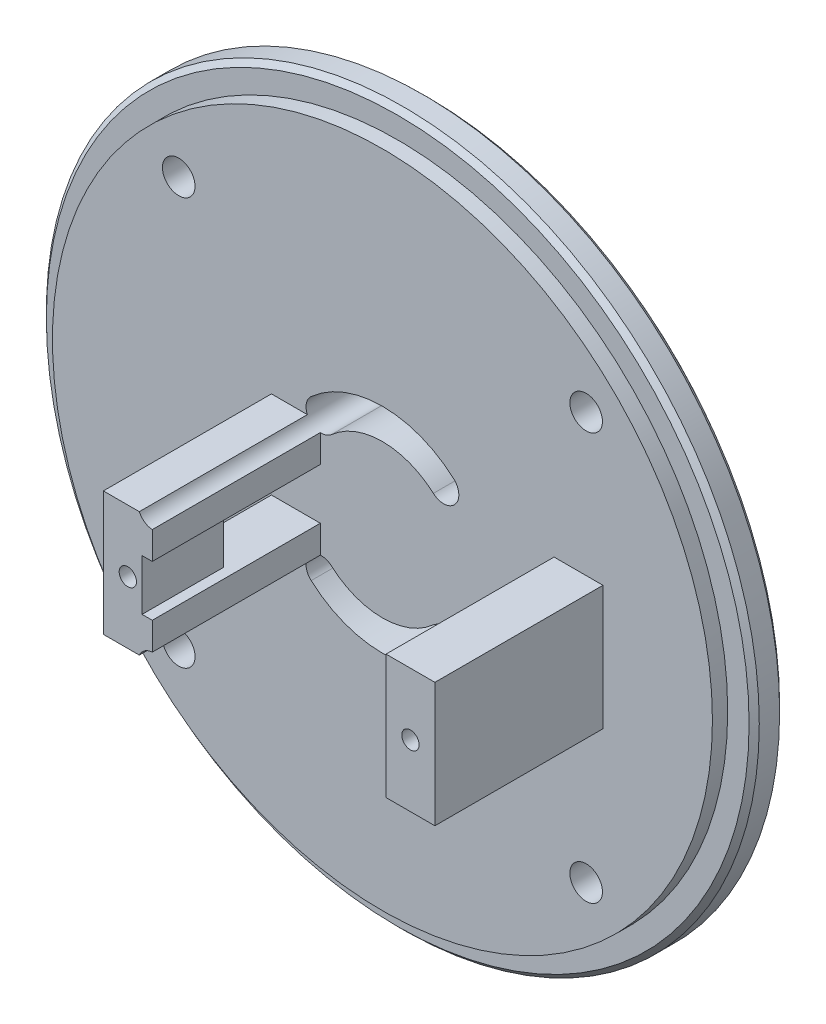
from build123d import *

# Parameters (mm, degrees)
SKIZZE1_R                       = 32.4
SKIZZE1_R_2                     = 1.8
AUFSATZ_LINEAR_AUSTRAGEN1_DEPTH = 3
SCHNITT_LINEAR_AUSTRAGEN1_DEPTH = 46.918623673
AUFSATZ_LINEAR_START            = 18
SKIZZE4_R                       = 0.85
SKIZZE4_W                       = 4.8
SKIZZE4_H                       = 12.19937625
AUFSATZ_LINEAR_AUSTRAGEN2_DEPTH = 18
SKIZZE5_W                       = 2
SKIZZE5_H                       = 5
SCHNITT_LINEAR_AUSTRAGEN2_DEPTH = 18
SKIZZE6_W                       = 10
SKIZZE6_H                       = 5
SCHNITT_LINEAR_AUSTRAGEN3_DEPTH = 18
FL_CHE_VERSCHIEBEN1_BY          = 1.5
SKIZZE8_R                       = 35
SKIZZE8_R_2                     = 32.4
AUFSATZ_LINEAR_AUSTRAGEN3_DEPTH = 3
SKIZZE9_R                       = 1.8
SKIZZE9_R_2                     = 1.6
AUFSATZ_LINEAR_AUSTRAGEN4_DEPTH = 4.5
FL_CHE_VERSCHIEBEN2_OUTLINE_R   = 35
FL_CHE_VERSCHIEBEN2_OUTLINE_R_2 = 1.6
FL_CHE_VERSCHIEBEN2_OUTLINE_W   = 4.8
FL_CHE_VERSCHIEBEN2_OUTLINE_H   = 12.19937625
FL_CHE_VERSCHIEBEN2_DEPTH       = 1.5
SKIZZE10_R                      = 36.675991258
SKIZZE10_R_2                    = 32.4
SCHNITT_LINEAR_AUSTRAGEN4_DEPTH = 1.5
FASE1_SIZE                      = 0.5


# Read off the part's stored shape, not the designer's step: Fläche verschieben2
with BuildPart() as part:
    # Skizze1 → Aufsatz-Linear austragen1 (new body)
    with BuildSketch(Plane.XY):
        Circle(SKIZZE1_R)
        with Locations((-20, -20)):
            Circle(SKIZZE1_R_2, mode=Mode.SUBTRACT)
        with Locations((20, -20)):
            Circle(SKIZZE1_R_2, mode=Mode.SUBTRACT)
        with Locations((20, 20)):
            Circle(SKIZZE1_R_2, mode=Mode.SUBTRACT)
        with Locations((-20, 20)):
            Circle(SKIZZE1_R_2, mode=Mode.SUBTRACT)
    extrude(amount=-AUFSATZ_LINEAR_AUSTRAGEN1_DEPTH)

    # Skizze2 → Schnitt-Linear austragen1 (cut, through all)
    with BuildSketch(Plane.XY):
        with BuildLine():
            ThreePointArc((5, 5.590169944), (0, 7.5), (-5, 5.590169944))
            ThreePointArc((-5, 5.590169944), (-5.511799249, 5.289873919), (-6.1, 5.211540978))
            ThreePointArc((-6.1, 5.211540978), (-6.859313681, 5.478740636), (-7.371163001, 6.1))
            ThreePointArc((-7.371163001, 6.1), (-7.466484857, 7.023516737), (-7, 7.826237921))
            ThreePointArc((-7, 7.826237921), (0, 10.5), (7, 7.826237921))
            ThreePointArc((7, 7.826237921), (7.118033989, 5.708203932), (5, 5.590169944))
        make_face()
        with BuildLine():
            ThreePointArc((-7, -7.826237921), (0, -10.5), (7, -7.826237921))
            ThreePointArc((7, -7.826237921), (7.118033989, -5.708203932), (5, -5.590169944))
            ThreePointArc((5, -5.590169944), (0, -7.5), (-5, -5.590169944))
            ThreePointArc((-5, -5.590169944), (-5.511799249, -5.289873919), (-6.1, -5.211540978))
            ThreePointArc((-6.1, -5.211540978), (-6.859313681, -5.478740636), (-7.371163001, -6.1))
            ThreePointArc((-7.371163001, -6.1), (-7.466484857, -7.023516737), (-7, -7.826237921))
        make_face()
    extrude(amount=-SCHNITT_LINEAR_AUSTRAGEN1_DEPTH, mode=Mode.SUBTRACT)

    # Skizze4 → Aufsatz-Linear austragen2 (add)
    # profile 1 of 2: a face of its own
    with BuildSketch(Plane.XY.offset(AUFSATZ_LINEAR_START)):
        with BuildLine():
            Line((-10.9, 6.1), (-10.9, -6.1))
            Line((-10.9, -6.1), (-7.371163001, -6.1))
            ThreePointArc((-7.371163001, -6.1), (-6.859313681, -5.478740636), (-6.1, -5.211540978))
            Line((-6.1, -5.211540978), (-6.1, 0.782623792))
            Line((-6.1, 0.782623792), (-6.1, 5.211540978))
            ThreePointArc((-6.1, 5.211540978), (-6.859313681, 5.478740636), (-7.371163001, 6.1))
            Line((-7.371163001, 6.1), (-10.9, 6.1))
        make_face()
        with Locations((-8.5, 0)):
            Circle(SKIZZE4_R, mode=Mode.SUBTRACT)
    # profile 2 of 2: a face of its own
    with BuildSketch(Plane.XY.offset(AUFSATZ_LINEAR_START)):
        with Locations((19.25, 0)):
            Rectangle(SKIZZE4_W, SKIZZE4_H)
        with Locations((19.25, 0)):
            Circle(SKIZZE4_R, mode=Mode.SUBTRACT)
    extrude(amount=-AUFSATZ_LINEAR_AUSTRAGEN2_DEPTH)

    # Skizze5 → Schnitt-Linear austragen2 (cut)
    with BuildSketch(Plane.XY.offset(18)):
        with Locations((-6.1, 0)):
            Rectangle(SKIZZE5_W, SKIZZE5_H)
    extrude(amount=-SCHNITT_LINEAR_AUSTRAGEN2_DEPTH, mode=Mode.SUBTRACT)

    # Skizze6 → Schnitt-Linear austragen3 (cut)
    with BuildSketch(Plane.ZY.offset(10.9)):
        with Locations((5, 0)):
            Rectangle(SKIZZE6_W, SKIZZE6_H)
    extrude(amount=-SCHNITT_LINEAR_AUSTRAGEN3_DEPTH, mode=Mode.SUBTRACT)

    # Fläche verschieben1: a face moved outward by 1.5
    extrude(part.faces().sort_by_distance((0, 0, -3))[0], amount=FL_CHE_VERSCHIEBEN1_BY, dir=(0, 0, -1))

    # Skizze8 → Aufsatz-Linear austragen3 (add)
    with BuildSketch(Plane.XY):
        Circle(SKIZZE8_R)
        Circle(SKIZZE8_R_2, mode=Mode.SUBTRACT)
    extrude(amount=-AUFSATZ_LINEAR_AUSTRAGEN3_DEPTH)

    # Skizze9 → Aufsatz-Linear austragen4 (add)
    # profile 1 of 4: a face of its own
    with BuildSketch(Plane.XY):
        with Locations((-20, 20)):
            Circle(SKIZZE9_R)
        with Locations((-20, 20)):
            Circle(SKIZZE9_R_2, mode=Mode.SUBTRACT)
    # profile 2 of 4: a face of its own
    with BuildSketch(Plane.XY):
        with Locations((20, 20)):
            Circle(SKIZZE9_R)
        with Locations((20, 20)):
            Circle(SKIZZE9_R_2, mode=Mode.SUBTRACT)
    # profile 3 of 4: a face of its own
    with BuildSketch(Plane.XY):
        with Locations((20, -20)):
            Circle(SKIZZE9_R)
        with Locations((20, -20)):
            Circle(SKIZZE9_R_2, mode=Mode.SUBTRACT)
    # profile 4 of 4: a face of its own
    with BuildSketch(Plane.XY):
        with Locations((-20, -20)):
            Circle(SKIZZE9_R)
        with Locations((-20, -20)):
            Circle(SKIZZE9_R_2, mode=Mode.SUBTRACT)
    extrude(amount=-AUFSATZ_LINEAR_AUSTRAGEN4_DEPTH)

    # Fläche verschieben2 outline → Fläche verschieben2 (add)
    with BuildSketch(Plane.XY):
        Circle(FL_CHE_VERSCHIEBEN2_OUTLINE_R)
        with Locations((-20, -20)):
            Circle(FL_CHE_VERSCHIEBEN2_OUTLINE_R_2, mode=Mode.SUBTRACT)
        with BuildLine():
            ThreePointArc((7, -7.826237921), (0, -10.5), (-7, -7.826237921))
            ThreePointArc((-7, -7.826237921), (-7.466484857, -7.023516737), (-7.371163002, -6.1))
            Line((-7.371163002, -6.1), (-10.9, -6.1))
            Line((-10.9, -6.1), (-10.9, -2.5))
            Line((-10.9, -2.5), (-6.1, -2.5))
            Line((-6.1, -2.5), (-6.1, -5.211540977))
            ThreePointArc((-6.1, -5.211540977), (-5.511799249, -5.289873919), (-5, -5.590169944))
            ThreePointArc((-5, -5.590169944), (0, -7.5), (5, -5.590169944))
            ThreePointArc((5, -5.590169944), (7.118033989, -5.708203932), (7, -7.826237921))
        make_face(mode=Mode.SUBTRACT)
        with Locations((20, -20)):
            Circle(FL_CHE_VERSCHIEBEN2_OUTLINE_R_2, mode=Mode.SUBTRACT)
        with BuildLine():
            Line((-6.1, 2.5), (-10.9, 2.5))
            Line((-10.9, 2.5), (-10.9, 6.1))
            Line((-10.9, 6.1), (-7.371163002, 6.1))
            ThreePointArc((-7.371163002, 6.1), (-7.466484857, 7.023516737), (-7, 7.826237921))
            ThreePointArc((-7, 7.826237921), (0, 10.5), (7, 7.826237921))
            ThreePointArc((7, 7.826237921), (7.118033989, 5.708203932), (5, 5.590169944))
            ThreePointArc((5, 5.590169944), (0, 7.5), (-5, 5.590169944))
            ThreePointArc((-5, 5.590169944), (-5.511799249, 5.289873919), (-6.1, 5.211540977))
            Line((-6.1, 5.211540977), (-6.1, 2.5))
        make_face(mode=Mode.SUBTRACT)
        with Locations((-20, 20)):
            Circle(FL_CHE_VERSCHIEBEN2_OUTLINE_R_2, mode=Mode.SUBTRACT)
        with Locations((19.25, 0)):
            Rectangle(FL_CHE_VERSCHIEBEN2_OUTLINE_W, FL_CHE_VERSCHIEBEN2_OUTLINE_H, mode=Mode.SUBTRACT)
        with Locations((20, 20)):
            Circle(FL_CHE_VERSCHIEBEN2_OUTLINE_R_2, mode=Mode.SUBTRACT)
    extrude(amount=FL_CHE_VERSCHIEBEN2_DEPTH)

    # Skizze10 → Schnitt-Linear austragen4 (cut)
    with BuildSketch(Plane.XY.offset(1.5)):
        Circle(SKIZZE10_R)
        Circle(SKIZZE10_R_2, mode=Mode.SUBTRACT)
    extrude(amount=-SCHNITT_LINEAR_AUSTRAGEN4_DEPTH, mode=Mode.SUBTRACT)

    # Fase1
    fase1_edges = [part.edges().sort_by_distance(p)[0] for p in [
        (-35, 0, -3),
        (-35, 0, 0),
    ]]
    chamfer(fase1_edges, length=FASE1_SIZE)


solid = part.part
